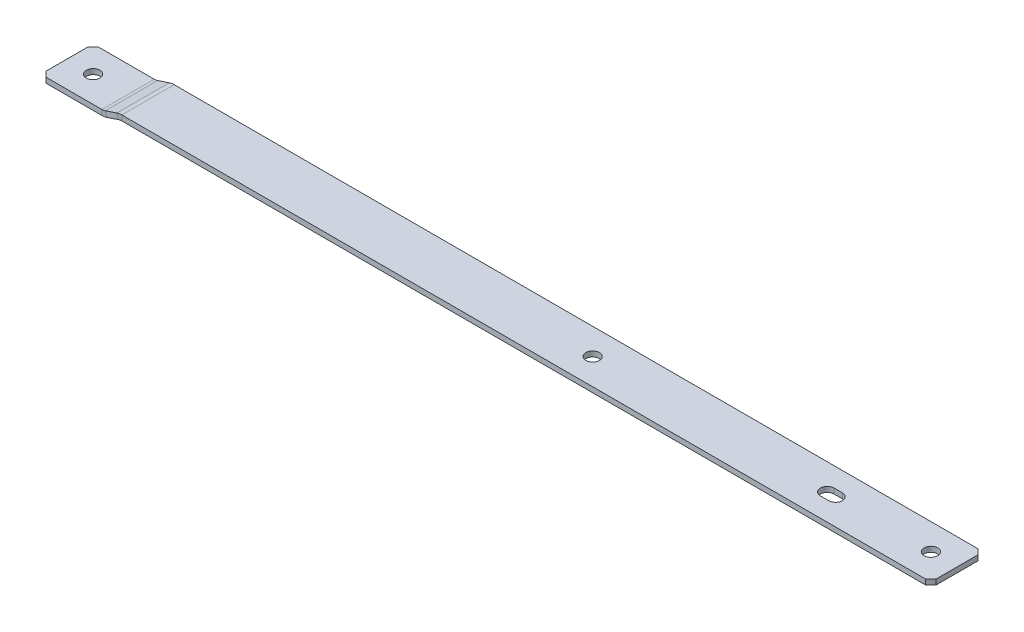
from build123d import *

# Parameters (mm, degrees)
SM_BASE_FLANGE_1_DEPTH = 50
SKETCH_2_R             = 6.5
CUT_EXTRUDE_1_DEPTH    = 10
CUT_EXTRUDE_2_DEPTH    = 10
SKETCH_4_R             = 6.5
CUT_EXTRUDE_3_DEPTH    = 10
SKETCH_5_R             = 6.5
CUT_EXTRUDE_4_DEPTH    = 10
OTHER_START            = -10
OTHER_1_DEPTH          = 10


# Read off the part's stored shape, not the designer's step: Затупленный угол1
# Sheet-metal steps are written as plain solids
with BuildPart() as part:
    # Sketch 1 → Базовая кромка1 (new body)
    with BuildSketch(Plane.XY):
        with BuildLine():
            Line((-381.414527052, -5), (-323.037303653, -5))
            ThreePointArc((-323.037303653, -5), (-321.435481223, -4.870874576), (-319.875025993, -4.486832981))
            Line((-319.875025993, -4.486832981), (-308.723778639, -0.769750529))
            ThreePointArc((-308.723778639, -0.769750529), (-306.383095794, -0.193688135), (-303.980362149, 0))
            Line((-303.980362149, 0), (468.585472948, 0))
            Line((468.585472948, 0), (468.585472948, -5))
            Line((468.585472948, -5), (-303.980362149, -5))
            ThreePointArc((-303.980362149, -5), (-305.582184579, -5.129125424), (-307.142639809, -5.513167019))
            Line((-307.142639809, -5.513167019), (-318.293887163, -9.230249471))
            ThreePointArc((-318.293887163, -9.230249471), (-320.634570008, -9.806311865), (-323.037303653, -10))
            Line((-323.037303653, -10), (-381.414527052, -10))
            Line((-381.414527052, -10), (-381.414527052, -5))
        make_face()
    extrude(amount=SM_BASE_FLANGE_1_DEPTH)

    # Sketch 2 → Вырез-Вытянуть1 (cut)
    with BuildSketch(Plane(origin=(0, 0, 0), x_dir=(1, 0, 0), z_dir=(0, 1, 0))):
        with Locations(Location((443.585472948, -25, 0), (0, 0, 270))):
            Circle(SKETCH_2_R)
    extrude(amount=-CUT_EXTRUDE_1_DEPTH, mode=Mode.SUBTRACT)

    # Эскиз3 → Вырез-Вытянуть2 (cut)
    with BuildSketch(Plane(origin=(0, 0, 0), x_dir=(1, 0, 0), z_dir=(0, 1, 0))):
        with BuildLine():
            Line((344.585472948, -18.5), (352.585472948, -18.5))
            ThreePointArc((352.585472948, -18.5), (359.085472948, -25), (352.585472948, -31.5))
            Line((352.585472948, -31.5), (344.585472948, -31.5))
            ThreePointArc((344.585472948, -31.5), (338.085472948, -25), (344.585472948, -18.5))
        make_face()
    extrude(amount=-CUT_EXTRUDE_2_DEPTH, mode=Mode.SUBTRACT)

    # Эскиз4 → Вырез-Вытянуть3 (cut)
    with BuildSketch(Plane(origin=(0, 0, 0), x_dir=(1, 0, 0), z_dir=(0, 1, 0))):
        with Locations(Location((120.585472948, -25, 0), (0, 0, 270))):
            Circle(SKETCH_4_R)
    extrude(amount=-CUT_EXTRUDE_3_DEPTH, mode=Mode.SUBTRACT)

    # Эскиз5 → Вырез-Вытянуть4 (cut)
    with BuildSketch(Plane(origin=(0, -5, 0), x_dir=(1, 0, 0), z_dir=(0, 1, 0))):
        with Locations(Location((-356.414527052, -25, 0), (0, 0, 270))):
            Circle(SKETCH_5_R)
    extrude(amount=-CUT_EXTRUDE_4_DEPTH, mode=Mode.SUBTRACT)

    # Other 1 outline → Other 1 (cut)
    with BuildSketch(Plane(origin=(0, 0, 0), x_dir=(1, 0, 0), z_dir=(0, 1, 0)).offset(OTHER_START)):
        Polygon((468.585472948, 0), (463.585472948, 0), (468.585472948, -5), align=None)
        Polygon((468.585472948, -50), (468.585472948, -45), (463.585472948, -50), align=None)
        Polygon((-381.414527052, 0), (-381.414527052, -5), (-376.414527052, 0), align=None)
        Polygon((-376.414527052, -50), (-381.414527052, -45), (-381.414527052, -50), align=None)
    extrude(amount=OTHER_1_DEPTH, mode=Mode.SUBTRACT)


solid = part.part
